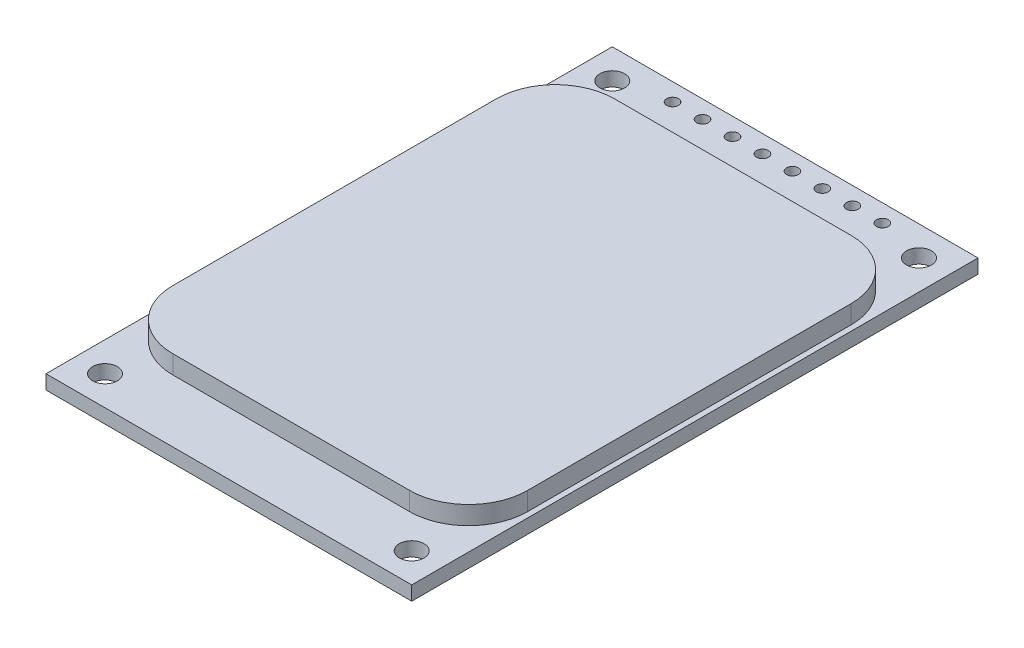
from build123d import *

# Parameters (mm, degrees)
SKETCH_1_W          = 31
SKETCH_1_H          = 48
EXTRUDE_1_DEPTH     = 1.2
CUT_EXTRUDE_1_REACH = 59.153
SKETCH_2_R          = 1.05
CUT_EXTRUDE_2_REACH = 59.153
SKETCH_3_R          = 0.5
SKETCH_4_W          = 30.07
SKETCH_4_H          = 37.43
EXTRUDE_2_DEPTH     = 1.56
FILLET_1_R          = 5


with BuildPart() as part:
    # 草图1 → 凸台-拉伸1 (new body)
    with BuildSketch(Plane(origin=(0, 0, 0), x_dir=(1, 0, 0), z_dir=(0, 1, 0))):
        with Locations((15.5, -24)):
            Rectangle(SKETCH_1_W, SKETCH_1_H)
    extrude(amount=EXTRUDE_1_DEPTH)

    # 草图2 → 切除-拉伸1 (cut, up to next)
    with BuildSketch(Plane(origin=(0, 1.2, 0), x_dir=(1, 0, 0), z_dir=(0, 1, 0)), mode=Mode.PRIVATE) as cut_extrude_1_sk1:
        with Locations((2.5, -2.5)):
            Circle(SKETCH_2_R)
    cut_extrude_1_tool1 = extrude(cut_extrude_1_sk1.sketch, amount=-CUT_EXTRUDE_1_REACH, mode=Mode.PRIVATE) & part.part
    # 草图2 → 切除-拉伸1 (cut, up to next)
    with BuildSketch(Plane(origin=(0, 1.2, 0), x_dir=(1, 0, 0), z_dir=(0, 1, 0)), mode=Mode.PRIVATE) as cut_extrude_1_sk2:
        with Locations((28.5, -2.5)):
            Circle(SKETCH_2_R)
    cut_extrude_1_tool2 = extrude(cut_extrude_1_sk2.sketch, amount=-CUT_EXTRUDE_1_REACH, mode=Mode.PRIVATE) & part.part
    # 草图2 → 切除-拉伸1 (cut, up to next)
    with BuildSketch(Plane(origin=(0, 1.2, 0), x_dir=(1, 0, 0), z_dir=(0, 1, 0)), mode=Mode.PRIVATE) as cut_extrude_1_sk3:
        with Locations((2.5, -45.5)):
            Circle(SKETCH_2_R)
    cut_extrude_1_tool3 = extrude(cut_extrude_1_sk3.sketch, amount=-CUT_EXTRUDE_1_REACH, mode=Mode.PRIVATE) & part.part
    # 草图2 → 切除-拉伸1 (cut, up to next)
    with BuildSketch(Plane(origin=(0, 1.2, 0), x_dir=(1, 0, 0), z_dir=(0, 1, 0)), mode=Mode.PRIVATE) as cut_extrude_1_sk4:
        with Locations((28.5, -45.5)):
            Circle(SKETCH_2_R)
    cut_extrude_1_tool4 = extrude(cut_extrude_1_sk4.sketch, amount=-CUT_EXTRUDE_1_REACH, mode=Mode.PRIVATE) & part.part
    add(cut_extrude_1_tool1.solids().sort_by_distance((2.5, 1.2, 2.5))[0], mode=Mode.SUBTRACT)
    add(cut_extrude_1_tool2.solids().sort_by_distance((28.5, 1.2, 2.5))[0], mode=Mode.SUBTRACT)
    add(cut_extrude_1_tool3.solids().sort_by_distance((2.5, 1.2, 45.5))[0], mode=Mode.SUBTRACT)
    add(cut_extrude_1_tool4.solids().sort_by_distance((28.5, 1.2, 45.5))[0], mode=Mode.SUBTRACT)

    # 草图3 → 切除-拉伸2 (cut, up to next)
    with BuildSketch(Plane(origin=(0, 1.2, 0), x_dir=(1, 0, 0), z_dir=(0, 1, 0)), mode=Mode.PRIVATE) as cut_extrude_2_sk1:
        with Locations((14.23, -1.5)):
            Circle(SKETCH_3_R)
    cut_extrude_2_tool1 = extrude(cut_extrude_2_sk1.sketch, amount=-CUT_EXTRUDE_2_REACH, mode=Mode.PRIVATE) & part.part
    # 草图3 → 切除-拉伸2 (cut, up to next)
    with BuildSketch(Plane(origin=(0, 1.2, 0), x_dir=(1, 0, 0), z_dir=(0, 1, 0)), mode=Mode.PRIVATE) as cut_extrude_2_sk2:
        with Locations((11.69, -1.5)):
            Circle(SKETCH_3_R)
    cut_extrude_2_tool2 = extrude(cut_extrude_2_sk2.sketch, amount=-CUT_EXTRUDE_2_REACH, mode=Mode.PRIVATE) & part.part
    # 草图3 → 切除-拉伸2 (cut, up to next)
    with BuildSketch(Plane(origin=(0, 1.2, 0), x_dir=(1, 0, 0), z_dir=(0, 1, 0)), mode=Mode.PRIVATE) as cut_extrude_2_sk3:
        with Locations((9.15, -1.5)):
            Circle(SKETCH_3_R)
    cut_extrude_2_tool3 = extrude(cut_extrude_2_sk3.sketch, amount=-CUT_EXTRUDE_2_REACH, mode=Mode.PRIVATE) & part.part
    # 草图3 → 切除-拉伸2 (cut, up to next)
    with BuildSketch(Plane(origin=(0, 1.2, 0), x_dir=(1, 0, 0), z_dir=(0, 1, 0)), mode=Mode.PRIVATE) as cut_extrude_2_sk4:
        with Locations((6.61, -1.5)):
            Circle(SKETCH_3_R)
    cut_extrude_2_tool4 = extrude(cut_extrude_2_sk4.sketch, amount=-CUT_EXTRUDE_2_REACH, mode=Mode.PRIVATE) & part.part
    # 草图3 → 切除-拉伸2 (cut, up to next)
    with BuildSketch(Plane(origin=(0, 1.2, 0), x_dir=(1, 0, 0), z_dir=(0, 1, 0)), mode=Mode.PRIVATE) as cut_extrude_2_sk5:
        with Locations((24.39, -1.5)):
            Circle(SKETCH_3_R)
    cut_extrude_2_tool5 = extrude(cut_extrude_2_sk5.sketch, amount=-CUT_EXTRUDE_2_REACH, mode=Mode.PRIVATE) & part.part
    # 草图3 → 切除-拉伸2 (cut, up to next)
    with BuildSketch(Plane(origin=(0, 1.2, 0), x_dir=(1, 0, 0), z_dir=(0, 1, 0)), mode=Mode.PRIVATE) as cut_extrude_2_sk6:
        with Locations((21.85, -1.5)):
            Circle(SKETCH_3_R)
    cut_extrude_2_tool6 = extrude(cut_extrude_2_sk6.sketch, amount=-CUT_EXTRUDE_2_REACH, mode=Mode.PRIVATE) & part.part
    # 草图3 → 切除-拉伸2 (cut, up to next)
    with BuildSketch(Plane(origin=(0, 1.2, 0), x_dir=(1, 0, 0), z_dir=(0, 1, 0)), mode=Mode.PRIVATE) as cut_extrude_2_sk7:
        with Locations((19.31, -1.5)):
            Circle(SKETCH_3_R)
    cut_extrude_2_tool7 = extrude(cut_extrude_2_sk7.sketch, amount=-CUT_EXTRUDE_2_REACH, mode=Mode.PRIVATE) & part.part
    # 草图3 → 切除-拉伸2 (cut, up to next)
    with BuildSketch(Plane(origin=(0, 1.2, 0), x_dir=(1, 0, 0), z_dir=(0, 1, 0)), mode=Mode.PRIVATE) as cut_extrude_2_sk8:
        with Locations((16.77, -1.5)):
            Circle(SKETCH_3_R)
    cut_extrude_2_tool8 = extrude(cut_extrude_2_sk8.sketch, amount=-CUT_EXTRUDE_2_REACH, mode=Mode.PRIVATE) & part.part
    add(cut_extrude_2_tool1.solids().sort_by_distance((14.23, 1.2, 1.5))[0], mode=Mode.SUBTRACT)
    add(cut_extrude_2_tool2.solids().sort_by_distance((11.69, 1.2, 1.5))[0], mode=Mode.SUBTRACT)
    add(cut_extrude_2_tool3.solids().sort_by_distance((9.15, 1.2, 1.5))[0], mode=Mode.SUBTRACT)
    add(cut_extrude_2_tool4.solids().sort_by_distance((6.61, 1.2, 1.5))[0], mode=Mode.SUBTRACT)
    add(cut_extrude_2_tool5.solids().sort_by_distance((24.39, 1.2, 1.5))[0], mode=Mode.SUBTRACT)
    add(cut_extrude_2_tool6.solids().sort_by_distance((21.85, 1.2, 1.5))[0], mode=Mode.SUBTRACT)
    add(cut_extrude_2_tool7.solids().sort_by_distance((19.31, 1.2, 1.5))[0], mode=Mode.SUBTRACT)
    add(cut_extrude_2_tool8.solids().sort_by_distance((16.77, 1.2, 1.5))[0], mode=Mode.SUBTRACT)

    # 草图4 → 凸台-拉伸2 (add)
    with BuildSketch(Plane(origin=(0, 1.2, 0), x_dir=(1, 0, 0), z_dir=(0, 1, 0))):
        with Locations((15.5, -24)):
            Rectangle(SKETCH_4_W, SKETCH_4_H)
    extrude(amount=EXTRUDE_2_DEPTH)

    # 圆角1
    fillet_1_edges = [part.edges().sort_by_distance(p)[0] for p in [
        (0.465, 1.98, 42.715),
        (30.535, 1.98, 42.715),
        (30.535, 1.98, 5.285),
        (0.465, 1.98, 5.285),
    ]]
    fillet(fillet_1_edges, radius=FILLET_1_R)


solid = part.part
